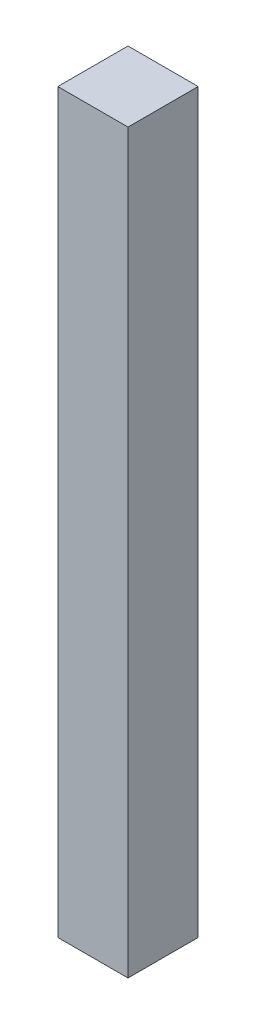
from build123d import *

# Parameters (mm, degrees)
SKETCH2_W           = 6
SKETCH2_H           = 6
BOSS_EXTRUDE1_DEPTH = 63


with BuildPart() as part:
    # Sketch2 → Boss-Extrude1 (new body)
    with BuildSketch(Plane(origin=(0, 0, 0), x_dir=(1, 0, 0), z_dir=(0, 1, 0))):
        Rectangle(SKETCH2_W, SKETCH2_H)
    extrude(amount=BOSS_EXTRUDE1_DEPTH)


solid = part.part
